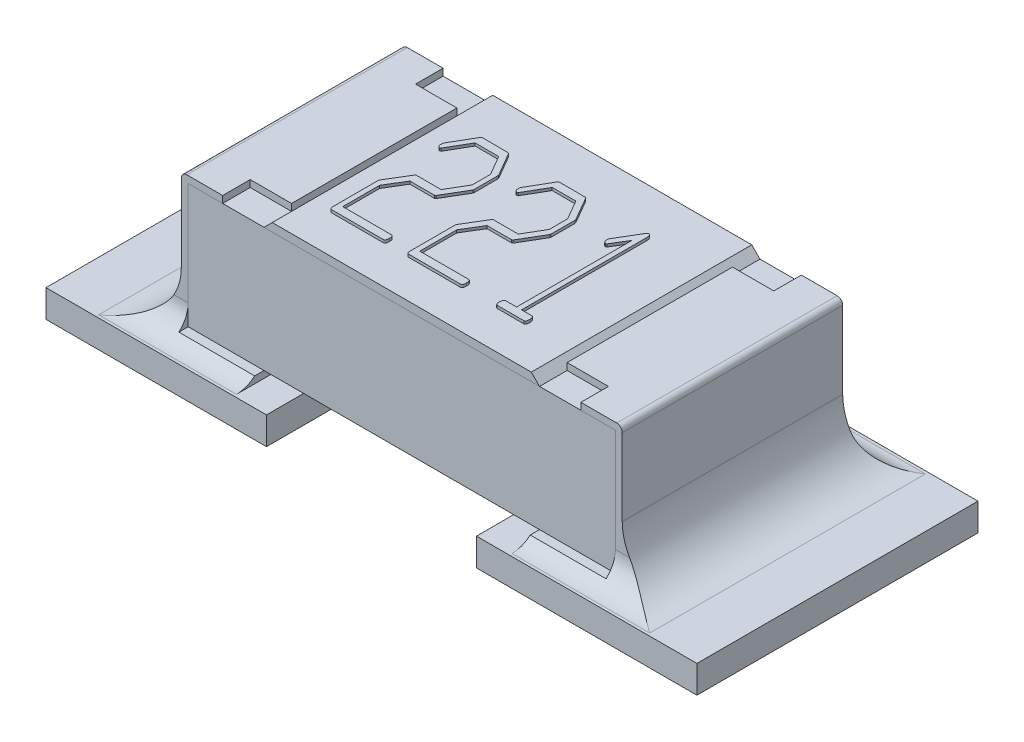
from build123d import *

# Parameters (mm, degrees)
SKETCH1_W             = 0.8
SKETCH1_H             = 0.45
BOSS_EXTRUDE1_DEPTH   = 0.775
BOSS_EXTRUDE2_DEPTH   = 0.4
BOSS_EXTRUDE2_2_DEPTH = 0.4
SKETCH3_W             = 0.15
SKETCH3_H             = 0.1
CUT_EXTRUDE1_DEPTH    = 0.025
BOSS_EXTRUDE3_DEPTH   = 0.4
BOSS_EXTRUDE4_DEPTH   = 0.01
SKETCH7_W             = 0.8
SKETCH7_H             = 1.02
BOSS_EXTRUDE5_DEPTH   = 0.1
FILLET3_R             = 0.2
FILLET4_R             = 0.2
FILLET5_R             = 0.1
FILLET6_R             = 0.1


with BuildPart() as part:
    # Sketch1 → Boss-Extrude1 (new, symmetric)
    with BuildSketch(Plane(origin=(0, 0, 0), x_dir=(0, 0, -1), z_dir=(1, 0, 0))):
        with Locations((0, 0.35)):
            Rectangle(SKETCH1_W, SKETCH1_H)
    extrude(amount=BOSS_EXTRUDE1_DEPTH, both=True)


with BuildPart() as body_2:
    # Sketch2 → Boss-Extrude2 (new, symmetric)
    with BuildSketch(Plane.XY):
        with BuildLine():
            Line((-0.5, 0.6), (-0.78, 0.6))
            ThreePointArc((-0.78, 0.6), (-0.794142136, 0.594142136), (-0.8, 0.58))
            Line((-0.8, 0.58), (-0.8, 0.1))
            Line((-0.8, 0.1), (-0.5, 0.1))
            Line((-0.5, 0.1), (-0.5, 0.125))
            Line((-0.5, 0.125), (-0.775, 0.125))
            Line((-0.775, 0.125), (-0.775, 0.575))
            Line((-0.775, 0.575), (-0.5, 0.575))
            Line((-0.5, 0.575), (-0.5, 0.6))
        make_face()
    extrude(amount=BOSS_EXTRUDE2_DEPTH, both=True)


with BuildPart() as body_3:
    # Sketch2 → Boss-Extrude2 2 (new, symmetric)
    with BuildSketch(Plane.XY):
        with BuildLine():
            Line((0.5, 0.575), (0.5, 0.6))
            Line((0.5, 0.6), (0.78, 0.6))
            ThreePointArc((0.78, 0.6), (0.794142136, 0.594142136), (0.8, 0.58))
            Line((0.8, 0.58), (0.8, 0.1))
            Line((0.8, 0.1), (0.5, 0.1))
            Line((0.5, 0.1), (0.5, 0.125))
            Line((0.5, 0.125), (0.775, 0.125))
            Line((0.775, 0.125), (0.775, 0.575))
            Line((0.775, 0.575), (0.5, 0.575))
        make_face()
    extrude(amount=BOSS_EXTRUDE2_2_DEPTH, both=True)


with BuildPart() as cut_extrude1_tool:
    # Sketch3 → Cut-Extrude1 (new body)
    with BuildSketch(Plane(origin=(0, 0.6, 0), x_dir=(1, 0, 0), z_dir=(0, 1, 0))):
        with Locations((-0.575, 0.35)):
            Rectangle(SKETCH3_W, SKETCH3_H)
        with Locations((-0.575, -0.35)):
            Rectangle(SKETCH3_W, SKETCH3_H)
        with Locations((0.575, -0.35)):
            Rectangle(SKETCH3_W, SKETCH3_H)
        with Locations((0.575, 0.35)):
            Rectangle(SKETCH3_W, SKETCH3_H)
    extrude(amount=-CUT_EXTRUDE1_DEPTH)


with BuildPart() as body_2_1:
    add(body_2.part)

    # Cut-Extrude1: cut by cut_extrude1_tool
    add(cut_extrude1_tool.part, mode=Mode.SUBTRACT)



with BuildPart() as body_3_1:
    add(body_3.part)

    # Cut-Extrude1: cut by cut_extrude1_tool
    add(cut_extrude1_tool.part, mode=Mode.SUBTRACT)


with BuildPart() as body_4:
    # Sketch4 → Boss-Extrude3 (new, symmetric)
    with BuildSketch(Plane.XY):
        Polygon((-0.5, 0.575), (0.5, 0.575), (0.47, 0.605), (-0.47, 0.605), align=None)
    extrude(amount=BOSS_EXTRUDE3_DEPTH, both=True)

    # Sketch6 → Boss-Extrude4 (add)
    with BuildSketch(Plane(origin=(0, 0.605, 0), x_dir=(1, 0, 0), z_dir=(0, 1, 0))):
        with BuildLine():
            Line((-0.246912202, 0.234002976), (-0.198456101, 0.150204613))
            Line((-0.198456101, 0.150204613), (-0.197619048, 0.143973214))
            Line((-0.197619048, 0.143973214), (-0.197619048, 0.060918899))
            Line((-0.197619048, 0.060918899), (-0.198456101, 0.056082589))
            Line((-0.198456101, 0.056082589), (-0.247935268, -0.027715774))
            Line((-0.247935268, -0.027715774), (-0.2515625, -0.029761905))
            Line((-0.2515625, -0.029761905), (-0.340569196, -0.029761905))
            Line((-0.340569196, -0.029761905), (-0.382142857, -0.09812128))
            Line((-0.382142857, -0.09812128), (-0.382142857, -0.232142857))
            Line((-0.382142857, -0.232142857), (-0.204036458, -0.232142857))
            add(Edge.make_bspline(
                [(-0.204036458, -0.232142857), (-0.203042924, -0.232556276), (-0.200938585, -0.233431911), (-0.19880848, -0.236818481), (-0.19776471, -0.241464864), (-0.197671246, -0.245031762), (-0.197619048, -0.24702381)],
                knots=[0, 0, 0, 0, 0.727922013, 1.541763566, 2.627120282, 4, 4, 4, 4], degree=3))
            add(Edge.make_bspline(
                [(-0.197619048, -0.24702381), (-0.19766219, -0.248986973), (-0.197742135, -0.252624852), (-0.198833276, -0.256848985), (-0.200171796, -0.259656481), (-0.201882099, -0.261012244), (-0.20404098, -0.26175373), (-0.20561119, -0.261851985), (-0.206454613, -0.261904762)],
                knots=[0, 0, 0, 0, 1.783226064, 3.304443306, 3.949222629, 4.571326795, 5.232602427, 6, 6, 6, 6], degree=3))
            Line((-0.206454613, -0.261904762), (-0.394791667, -0.261904762))
            add(Edge.make_bspline(
                [(-0.394791667, -0.261904762), (-0.395997862, -0.260801207), (-0.398600433, -0.2584201), (-0.399511291, -0.254998187), (-0.4, -0.253162202)],
                knots=[0, 0, 0, 0, 0.926925341, 2, 2, 2, 2], degree=3))
            Line((-0.4, -0.253162202), (-0.4, -0.239676339))
            Line((-0.4, -0.239676339), (-0.4, -0.083519345))
            Line((-0.4, -0.083519345), (-0.350334821, -0.001302083))
            Line((-0.350334821, -0.001302083), (-0.348009673, 0))
            Line((-0.348009673, 0), (-0.257142857, 0))
            Line((-0.257142857, 0), (-0.21547619, 0.07077753))
            Line((-0.21547619, 0.07077753), (-0.21547619, 0.137555804))
            Line((-0.21547619, 0.137555804), (-0.256491815, 0.208333333))
            Line((-0.256491815, 0.208333333), (-0.342243304, 0.208333333))
            Line((-0.342243304, 0.208333333), (-0.387630208, 0.130208333))
            add(Edge.make_bspline(
                [(-0.387630208, 0.130208333), (-0.388357871, 0.129817639), (-0.389620694, 0.129139609), (-0.391031564, 0.128910385), (-0.391629464, 0.128813244)],
                knots=[0, 0, 0, 0, 1.152437574, 2, 2, 2, 2], degree=3))
            add(Edge.make_bspline(
                [(-0.391629464, 0.128813244), (-0.392807912, 0.129002619), (-0.39532525, 0.129407153), (-0.398122994, 0.132865271), (-0.399842375, 0.137855724), (-0.39994275, 0.14181055), (-0.4, 0.14406622)],
                knots=[0, 0, 0, 0, 0.723786097, 1.5461138, 2.600403721, 4, 4, 4, 4], degree=3))
            Line((-0.4, 0.14406622), (-0.399162946, 0.150297619))
            Line((-0.399162946, 0.150297619), (-0.349869792, 0.23530506))
            Line((-0.349869792, 0.23530506), (-0.346707589, 0.238095238))
            Line((-0.346707589, 0.238095238), (-0.249702381, 0.237444196))
            Line((-0.249702381, 0.237444196), (-0.246912202, 0.234002976))
        make_face()
        with BuildLine():
            Line((0.032849702, 0.234002976), (0.081305804, 0.150204613))
            Line((0.081305804, 0.150204613), (0.082142857, 0.143973214))
            Line((0.082142857, 0.143973214), (0.082142857, 0.060918899))
            Line((0.082142857, 0.060918899), (0.081305804, 0.056082589))
            Line((0.081305804, 0.056082589), (0.031826637, -0.027715774))
            Line((0.031826637, -0.027715774), (0.028199405, -0.029761905))
            Line((0.028199405, -0.029761905), (-0.060807292, -0.029761905))
            Line((-0.060807292, -0.029761905), (-0.102380952, -0.09812128))
            Line((-0.102380952, -0.09812128), (-0.102380952, -0.232142857))
            Line((-0.102380952, -0.232142857), (0.075725446, -0.232142857))
            add(Edge.make_bspline(
                [(0.075725446, -0.232142857), (0.076718981, -0.232556276), (0.07882332, -0.233431911), (0.080953425, -0.236818481), (0.081997194, -0.241464864), (0.082090659, -0.245031762), (0.082142857, -0.24702381)],
                knots=[0, 0, 0, 0, 0.727922013, 1.541763566, 2.627120282, 4, 4, 4, 4], degree=3))
            add(Edge.make_bspline(
                [(0.082142857, -0.24702381), (0.082099715, -0.248986973), (0.08201977, -0.252624852), (0.080928628, -0.256848985), (0.079590109, -0.259656481), (0.077879806, -0.261012244), (0.075720925, -0.26175373), (0.074150714, -0.261851985), (0.073307292, -0.261904762)],
                knots=[0, 0, 0, 0, 1.783226064, 3.304443306, 3.949222629, 4.571326795, 5.232602427, 6, 6, 6, 6], degree=3))
            Line((0.073307292, -0.261904762), (-0.115029762, -0.261904762))
            add(Edge.make_bspline(
                [(-0.115029762, -0.261904762), (-0.116235957, -0.260801207), (-0.118838528, -0.2584201), (-0.119749386, -0.254998187), (-0.120238095, -0.253162202)],
                knots=[0, 0, 0, 0, 0.926925341, 2, 2, 2, 2], degree=3))
            Line((-0.120238095, -0.253162202), (-0.120238095, -0.239676339))
            Line((-0.120238095, -0.239676339), (-0.120238095, -0.083519345))
            Line((-0.120238095, -0.083519345), (-0.070572917, -0.001302083))
            Line((-0.070572917, -0.001302083), (-0.068247768, 0))
            Line((-0.068247768, 0), (0.022619048, 0))
            Line((0.022619048, 0), (0.064285714, 0.07077753))
            Line((0.064285714, 0.07077753), (0.064285714, 0.137555804))
            Line((0.064285714, 0.137555804), (0.023270089, 0.208333333))
            Line((0.023270089, 0.208333333), (-0.062481399, 0.208333333))
            Line((-0.062481399, 0.208333333), (-0.107868304, 0.130208333))
            add(Edge.make_bspline(
                [(-0.107868304, 0.130208333), (-0.108595966, 0.129817639), (-0.109858789, 0.129139609), (-0.111269659, 0.128910385), (-0.11186756, 0.128813244)],
                knots=[0, 0, 0, 0, 1.152437574, 2, 2, 2, 2], degree=3))
            add(Edge.make_bspline(
                [(-0.11186756, 0.128813244), (-0.113046007, 0.129002619), (-0.115563345, 0.129407153), (-0.118361089, 0.132865271), (-0.120080471, 0.137855724), (-0.120180845, 0.14181055), (-0.120238095, 0.14406622)],
                knots=[0, 0, 0, 0, 0.723786097, 1.5461138, 2.600403721, 4, 4, 4, 4], degree=3))
            Line((-0.120238095, 0.14406622), (-0.119401042, 0.150297619))
            Line((-0.119401042, 0.150297619), (-0.070107887, 0.23530506))
            Line((-0.070107887, 0.23530506), (-0.066945685, 0.238095238))
            Line((-0.066945685, 0.238095238), (0.030059524, 0.237444196))
            Line((0.030059524, 0.237444196), (0.032849702, 0.234002976))
        make_face()
        with BuildLine():
            Line((0.266666667, 0.221819196), (0.266666667, -0.232142857))
            Line((0.266666667, -0.232142857), (0.305915179, -0.232142857))
            add(Edge.make_bspline(
                [(0.305915179, -0.232142857), (0.307008894, -0.233159523), (0.309177687, -0.235175528), (0.31060257, -0.239323698), (0.311571809, -0.243100354), (0.3117123, -0.245561302), (0.311774554, -0.246651786)],
                knots=[0, 0, 0, 0, 1.094507773, 2.170363376, 3.18925981, 4, 4, 4, 4], degree=3))
            add(Edge.make_bspline(
                [(0.311774554, -0.246651786), (0.311733799, -0.24890061), (0.311663298, -0.252790757), (0.310596181, -0.257670974), (0.308566678, -0.261266063), (0.306359471, -0.261705298), (0.305357143, -0.261904762)],
                knots=[0, 0, 0, 0, 1.483935822, 2.566997854, 3.349251094, 4, 4, 4, 4], degree=3))
            Line((0.305357143, -0.261904762), (0.207235863, -0.261904762))
            add(Edge.make_bspline(
                [(0.207235863, -0.261904762), (0.206331965, -0.261383497), (0.204385532, -0.260261018), (0.202678784, -0.256793507), (0.201738841, -0.252323852), (0.201625713, -0.248923727), (0.2015625, -0.24702381)],
                knots=[0, 0, 0, 0, 0.731657516, 1.575533429, 2.645259425, 4, 4, 4, 4], degree=3))
            add(Edge.make_bspline(
                [(0.2015625, -0.24702381), (0.201676748, -0.245999991), (0.201980401, -0.24327885), (0.202668126, -0.239634421), (0.20377287, -0.236384481), (0.204808452, -0.234196716), (0.206398369, -0.232808963), (0.207591916, -0.232359173), (0.208165923, -0.232142857)],
                knots=[0, 0, 0, 0, 1.077846596, 2.864738214, 3.859388994, 4.671949365, 5.361307703, 6, 6, 6, 6], degree=3))
            Line((0.208165923, -0.232142857), (0.248809524, -0.232142857))
            Line((0.248809524, -0.232142857), (0.248809524, 0.186476935))
            Line((0.248809524, 0.186476935), (0.214304315, 0.130208333))
            add(Edge.make_bspline(
                [(0.214304315, 0.130208333), (0.213576779, 0.129816395), (0.21228718, 0.129121662), (0.210841948, 0.128906863), (0.210212054, 0.128813244)],
                knots=[0, 0, 0, 0, 1.128313794, 2, 2, 2, 2], degree=3))
            add(Edge.make_bspline(
                [(0.210212054, 0.128813244), (0.209582159, 0.128906863), (0.208136928, 0.129121662), (0.206847328, 0.129816395), (0.206119792, 0.130208333)],
                knots=[0, 0, 0, 0, 0.871686206, 2, 2, 2, 2], degree=3))
            add(Edge.make_bspline(
                [(0.206119792, 0.130208333), (0.204761774, 0.132029405), (0.201865732, 0.135912935), (0.201424699, 0.140752164), (0.201190476, 0.143322173)],
                knots=[0, 0, 0, 0, 0.937843913, 2, 2, 2, 2], degree=3))
            Line((0.201190476, 0.143322173), (0.202399554, 0.150297619))
            Line((0.202399554, 0.150297619), (0.252622768, 0.234654018))
            add(Edge.make_bspline(
                [(0.252622768, 0.234654018), (0.253471085, 0.23565958), (0.254907743, 0.23736254), (0.257047735, 0.237882361), (0.257924107, 0.238095238)],
                knots=[0, 0, 0, 0, 1.180958283, 2, 2, 2, 2], degree=3))
            add(Edge.make_bspline(
                [(0.257924107, 0.238095238), (0.259269262, 0.237901979), (0.262027645, 0.23750568), (0.265037819, 0.233775342), (0.266429179, 0.228376002), (0.266579771, 0.224218313), (0.266666667, 0.221819196)],
                knots=[0, 0, 0, 0, 0.76869288, 1.576286457, 2.601441333, 4, 4, 4, 4], degree=3))
        make_face()
    extrude(amount=BOSS_EXTRUDE4_DEPTH)


with BuildPart() as body_2_2:
    add(body_2_1.part)

    add(body_3_1.part)  # Boss-Extrude5 merges body 3
    # Sketch7 → Boss-Extrude5 (add)
    with BuildSketch(Plane(origin=(0, 0, 0), x_dir=(1, 0, 0), z_dir=(0, 1, 0))):
        with Locations((-0.781, 0)):
            Rectangle(SKETCH7_W, SKETCH7_H)
        with Locations((0.781, 0)):
            Rectangle(SKETCH7_W, SKETCH7_H)
    extrude(amount=BOSS_EXTRUDE5_DEPTH)

    # Fillet3
    fillet3_edges = [body_2_2.edges().sort_by_distance(p)[0] for p in [
        (-0.8, 0.1, 0),
    ]]
    fillet(fillet3_edges, radius=FILLET3_R)

    # Fillet4
    fillet4_edges = [body_2_2.edges().sort_by_distance(p)[0] for p in [
        (0.8, 0.1, 0),
    ]]
    fillet(fillet4_edges, radius=FILLET4_R)

    # Fillet5
    fillet5_edges = [body_2_2.edges().sort_by_distance(p)[0] for p in [
        (0.75, 0.1, 0.4),
    ]]
    fillet(fillet5_edges, radius=FILLET5_R)
    fillet5_2_edges = [body_2_2.edges().sort_by_distance(p)[0] for p in [
        (0.75, 0.1, -0.4),
    ]]
    fillet(fillet5_2_edges, radius=FILLET5_R)

    # Fillet6
    fillet6_edges = [body_2_2.edges().sort_by_distance(p)[0] for p in [
        (-0.75, 0.1, -0.4),
    ]]
    fillet(fillet6_edges, radius=FILLET6_R)
    fillet6_2_edges = [body_2_2.edges().sort_by_distance(p)[0] for p in [
        (-0.75, 0.1, 0.4),
    ]]
    fillet(fillet6_2_edges, radius=FILLET6_R)


solid = Compound([part.part, body_4.part, body_2_2.part])
